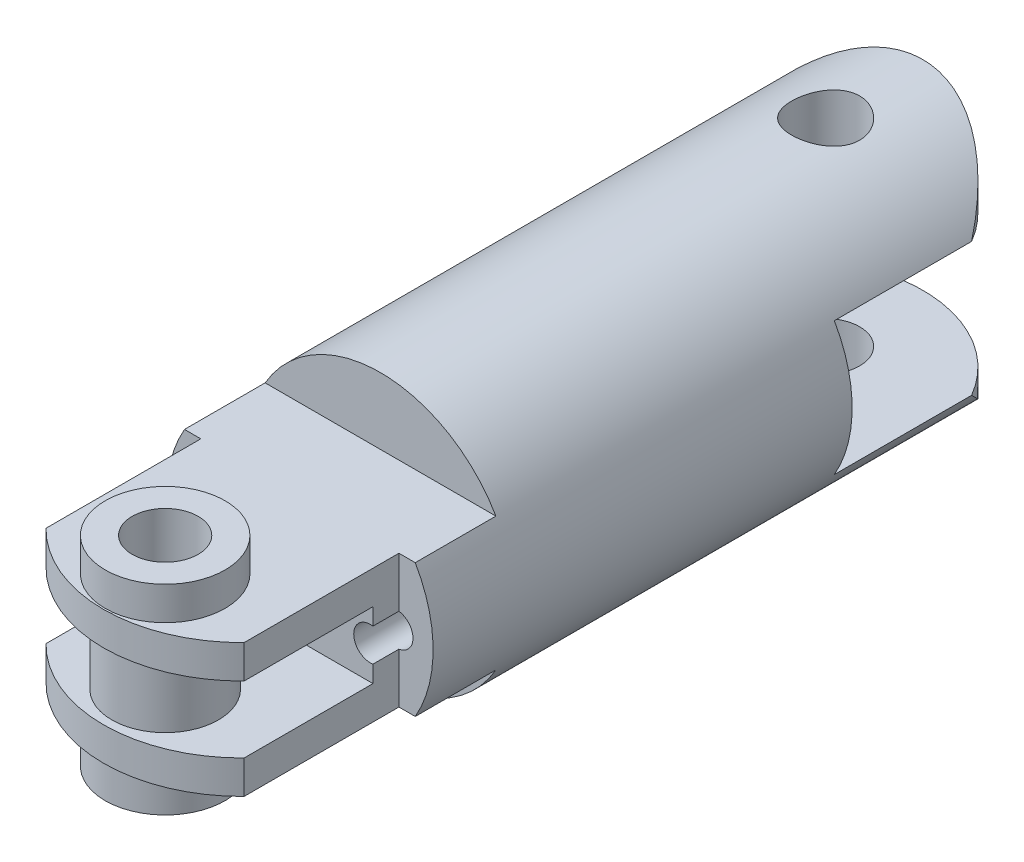
from build123d import *
from build123d.topology import SkipClean

# Parameters (mm, degrees)
SKETCH2_R                       = 10
PHALANGE_LENGTH_DEPTH           = 33.4
BOSS_EXTRUDE3_DEPTH             = 5
BOSS_EXTRUDE4_DEPTH             = 5
BOSS_EXTRUDE4_DEPTH_BACK        = 5
CUT_EXTRUDE2_START              = -15.3025
CUT_EXTRUDE2_DEPTH              = 15.3025
SKETCH7_R                       = 1.65
CUT_EXTRUDE3_DEPTH              = 10
CUT_EXTRUDE4_DEPTH              = 2.5
CUT_EXTRUDE4_DEPTH_BACK         = 2.5
CUT_EXTRUDE7_REACH              = 53.978
SKETCH4_R                       = 1.65
CUT_EXTRUDE7_DIRECTION_2_REACH  = 53.978
CUT_EXTRUDE_THIN1_START         = 33.4
CUT_EXTRUDE_THIN1_DEPTH         = 10.361670454
BOSS_EXTRUDE5_REACH             = 53.313
SKETCH9_R                       = 4
SKETCH9_R_2                     = 1.65
CUT_EXTRUDE8_REACH              = 52.714
SKETCH10_R                      = 1.25
CUT_EXTRUDE9_START              = -8
CUT_EXTRUDE9_DEPTH              = 8
CUT_EXTRUDE10_REACH             = 53.313
CUT_EXTRUDE10_DIRECTION_2_REACH = 53.313
CUT_EXTRUDE11_START             = -10
CUT_EXTRUDE11_OUTLINE_W         = 2.565773848
CUT_EXTRUDE11_OUTLINE_H         = 11.6166929
CUT_EXTRUDE11_DEPTH             = 10
BOSS_EXTRUDE6_START             = 7.5
SKETCH14_R                      = 4.5
SKETCH14_R_2                    = 1.65
BOSS_EXTRUDE6_DEPTH             = 2.5
BOSS_EXTRUDE7_START             = -7.5
SKETCH14_2_R                    = 4.5
SKETCH14_2_R_2                  = 1.65
BOSS_EXTRUDE7_DEPTH             = 2.5
SCALE1_SCALE                    = 0.666666667
CUT_EXTRUDE12_START             = -11.666667
SKETCH15_R                      = 1.65
CUT_EXTRUDE12_DEPTH             = 13.333339
CUT_EXTRUDE13_REACH             = 39.694
SKETCH16_R                      = 1.7
CUT_EXTRUDE13_DIRECTION_2_REACH = 39.694


# Read off the part's stored shape, not the designer's step: Cut-Extrude-Thin1, Cut-Extrude11
with BuildPart() as part:
    # Sketch2 → Phalange Length (new body)
    with BuildSketch(Plane.XY):
        Circle(SKETCH2_R)
    extrude(amount=PHALANGE_LENGTH_DEPTH)

    # Sketch3 → Boss-Extrude3 (add)
    with BuildSketch(Plane(origin=(0, -10, 0), x_dir=(-1, 0, 0), z_dir=(0, -1, 0))):
        with BuildLine():
            Line((-10, 5.302499701), (-10, 0))
            Line((-10, 0), (10, 0))
            Line((10, 0), (10, 5.302499701))
            ThreePointArc((10, 5.302499701), (0, 15.302499701), (-10, 5.302499701))
        make_face()
    boss_extrude3 = extrude(amount=-BOSS_EXTRUDE3_DEPTH)

    # Mirror1: Boss-Extrude3 across plane
    add(boss_extrude3.mirror(Plane.ZX))

    # Sketch5 → Boss-Extrude4 (add, two sides: drawn at the far end of the back side and taken through both)
    with BuildSketch(Plane(origin=(0, 0, 0), x_dir=(1, 0, 0), z_dir=(0, 1, 0)).offset(-BOSS_EXTRUDE4_DEPTH_BACK)):
        with BuildLine():
            Line((-10, -39.183157911), (-10, -33.4))
            Line((-10, -33.4), (10, -33.4))
            Line((10, -33.4), (10, -39.183157911))
            ThreePointArc((10, -39.183157911), (0, -48.751984156), (-10, -39.183157911))
        make_face()
    extrude(amount=BOSS_EXTRUDE4_DEPTH + BOSS_EXTRUDE4_DEPTH_BACK)

    # Sketch6 → Cut-Extrude2 (cut)
    with SkipClean():  # the faces are left unmerged after this step: merging them gives an invalid solid
        with BuildSketch(Plane.XY.offset(CUT_EXTRUDE2_START)):
            with BuildLine():
                ThreePointArc((0, 10), (5, 8.660254038), (8.660254038, 5))
                Line((8.660254038, 5), (10, 5))
                Line((10, 5), (10, 10))
                Line((10, 10), (0, 10))
            make_face()
            with BuildLine():
                Line((10, -5), (8.660254038, -5))
                ThreePointArc((8.660254038, -5), (5, -8.660254038), (0, -10))
                Line((0, -10), (10, -10))
                Line((10, -10), (10, -5))
            make_face()
            with BuildLine():
                ThreePointArc((-8.660254038, 5), (-5, 8.660254038), (0, 10))
                Line((0, 10), (-10, 10))
                Line((-10, 10), (-10, 5))
                Line((-10, 5), (-8.660254038, 5))
            make_face()
            with BuildLine():
                Line((-10, -10), (0, -10))
                ThreePointArc((0, -10), (-5, -8.660254038), (-8.660254038, -5))
                Line((-8.660254038, -5), (-10, -5))
                Line((-10, -5), (-10, -10))
            make_face()
        extrude(amount=CUT_EXTRUDE2_DEPTH, mode=Mode.SUBTRACT)

    # Sketch7 → Cut-Extrude3 (cut)
    with SkipClean():  # the faces are left unmerged after this step: merging them gives an invalid solid
        with BuildSketch(Plane(origin=(0, 5, 0), x_dir=(1, 0, 0), z_dir=(0, 1, 0))):
            with Locations(Location((0, -41.561984156, 0), (0, 0, 270))):
                Circle(SKETCH7_R)
        extrude(amount=-CUT_EXTRUDE3_DEPTH, mode=Mode.SUBTRACT)

    # Sketch5<2> → Cut-Extrude4 (cut, two sides: drawn at the far end of the back side and taken through both)
    with BuildSketch(Plane(origin=(0, 0, 0), x_dir=(1, 0, 0), z_dir=(0, 1, 0)).offset(-CUT_EXTRUDE4_DEPTH_BACK)):
        with BuildLine():
            Line((-10, -39.183157911), (-10, -33.4))
            Line((-10, -33.4), (10, -33.4))
            Line((10, -33.4), (10, -39.183157911))
            ThreePointArc((10, -39.183157911), (0, -48.751984156), (-10, -39.183157911))
        make_face()
    extrude(amount=CUT_EXTRUDE4_DEPTH + CUT_EXTRUDE4_DEPTH_BACK, mode=Mode.SUBTRACT)

    # Sketch4 → Cut-Extrude7 (cut, up to next)
    with BuildSketch(Plane(origin=(0, -5, 0), x_dir=(1, 0, 0), z_dir=(0, 1, 0)), mode=Mode.PRIVATE) as cut_extrude7_sk1:
        with Locations(Location((0, 8.010159673, 0), (0, 0, 270))):
            Circle(SKETCH4_R)
    cut_extrude7_tool1 = extrude(cut_extrude7_sk1.sketch, amount=-CUT_EXTRUDE7_REACH, mode=Mode.PRIVATE) & part.part
    add(cut_extrude7_tool1.solids().sort_by_distance((0, -5, -8.01016))[0], mode=Mode.SUBTRACT)

    # Sketch4 → Cut-Extrude7 direction 2 (cut, up to next)
    with BuildSketch(Plane(origin=(0, -5, 0), x_dir=(1, 0, 0), z_dir=(0, 1, 0)), mode=Mode.PRIVATE) as cut_extrude7_direction_2_sk1:
        with Locations(Location((0, 8.010159673, 0), (0, 0, 270))):
            Circle(SKETCH4_R)
    cut_extrude7_direction_2_tool1 = extrude(cut_extrude7_direction_2_sk1.sketch, amount=CUT_EXTRUDE7_DIRECTION_2_REACH, mode=Mode.PRIVATE) & part.part
    add(cut_extrude7_direction_2_tool1.solids().sort_by_distance((0, -5, -8.01016))[0], mode=Mode.SUBTRACT)

    # Cut-Extrude-Thin1 outline → Cut-Extrude-Thin1 (cut)
    with SkipClean():  # the faces are left unmerged after this step: merging them gives an invalid solid
        with BuildSketch(Plane.XY.offset(CUT_EXTRUDE_THIN1_START)):
            with BuildLine():
                ThreePointArc((8.660254038, 5), (9.256147934, 3.78466979), (9.682458366, 2.5))
                Line((9.682458366, 2.5), (10, 2.5))
                Line((10, 2.5), (10, 5))
                Line((10, 5), (8.660254038, 5))
            make_face()
            with BuildLine():
                Line((10, -2.5), (9.682458366, -2.5))
                ThreePointArc((9.682458366, -2.5), (9.256147934, -3.78466979), (8.660254038, -5))
                Line((8.660254038, -5), (10, -5))
                Line((10, -5), (10, -2.5))
            make_face()
            with BuildLine():
                Line((-10, 2.5), (-9.682458366, 2.5))
                ThreePointArc((-9.682458366, 2.5), (-9.256147934, 3.78466979), (-8.660254038, 5))
                Line((-8.660254038, 5), (-10, 5))
                Line((-10, 5), (-10, 2.5))
            make_face()
            with BuildLine():
                ThreePointArc((-8.660254038, -5), (-9.256147934, -3.78466979), (-9.682458366, -2.5))
                Line((-9.682458366, -2.5), (-10, -2.5))
                Line((-10, -2.5), (-10, -5))
                Line((-10, -5), (-8.660254038, -5))
            make_face()
        extrude(amount=CUT_EXTRUDE_THIN1_DEPTH, mode=Mode.SUBTRACT)

    # Sketch9 → Boss-Extrude5 (add, up to next)
    with BuildSketch(Plane.XZ.offset(-2.5), mode=Mode.PRIVATE) as boss_extrude5_sk1:
        with Locations(Location((0, 41.561984156, 0), (0, 0, 90))):
            Circle(SKETCH9_R)
        with Locations(Location((0, 41.561984156, 0), (0, 0, 90))):
            Circle(SKETCH9_R_2, mode=Mode.SUBTRACT)
    boss_extrude5_tool1 = extrude(boss_extrude5_sk1.sketch, amount=BOSS_EXTRUDE5_REACH, mode=Mode.PRIVATE) - part.part
    add(boss_extrude5_tool1.solids().sort_by_distance((0, 2.5, 37.675121))[0])

    # Sketch10 → Cut-Extrude8 (cut, up to next)
    with BuildSketch(Plane.XY.offset(33.4), mode=Mode.PRIVATE) as cut_extrude8_sk1:
        with Locations((7.239961745, 0)):
            Circle(SKETCH10_R)
    cut_extrude8_tool1 = extrude(cut_extrude8_sk1.sketch, amount=-CUT_EXTRUDE8_REACH, mode=Mode.PRIVATE) & part.part
    # Sketch10 → Cut-Extrude8 (cut, up to next)
    with BuildSketch(Plane.XY.offset(33.4), mode=Mode.PRIVATE) as cut_extrude8_sk2:
        with Locations((-7.239961745, 0)):
            Circle(SKETCH10_R)
    cut_extrude8_tool2 = extrude(cut_extrude8_sk2.sketch, amount=-CUT_EXTRUDE8_REACH, mode=Mode.PRIVATE) & part.part
    add(cut_extrude8_tool1.solids().sort_by_distance((7.239962, 0, 33.4))[0], mode=Mode.SUBTRACT)
    add(cut_extrude8_tool2.solids().sort_by_distance((-7.239962, 0, 33.4))[0], mode=Mode.SUBTRACT)

    # Sketch11 → Cut-Extrude9 (cut)
    with SkipClean():  # the faces are left unmerged after this step: merging them gives an invalid solid
        with BuildSketch(Plane.XY.offset(33.4).offset(CUT_EXTRUDE9_START)):
            with BuildLine():
                ThreePointArc((8.660254038, 5), (0, 10), (-8.660254038, 5))
                Line((-8.660254038, 5), (8.660254038, 5))
            make_face()
            with BuildLine():
                Line((8.660254038, -5), (-8.660254038, -5))
                ThreePointArc((-8.660254038, -5), (0, -10), (8.660254038, -5))
            make_face()
        extrude(amount=CUT_EXTRUDE9_DEPTH, mode=Mode.SUBTRACT)

    # Sketch12 → Cut-Extrude10 (cut, up to next)
    with BuildSketch(Plane.XZ.offset(-2.5), mode=Mode.PRIVATE) as cut_extrude10_sk1:
        with BuildLine():
            Line((-10.033719202, 48.751984156), (-10.033719202, 41.564892021))
            Line((-10.033719202, 41.564892021), (-8.660254038, 41.564892021))
            ThreePointArc((-8.660254038, 41.564892021), (0, 46.190740593), (8.660254038, 41.564892021))
            Line((8.660254038, 41.564892021), (10.033719202, 41.564892021))
            Line((10.033719202, 41.564892021), (10.033719202, 48.751984156))
            Line((10.033719202, 48.751984156), (-10.033719202, 48.751984156))
        make_face()
    cut_extrude10_tool1 = extrude(cut_extrude10_sk1.sketch, amount=CUT_EXTRUDE10_REACH, mode=Mode.PRIVATE) & part.part
    add(cut_extrude10_tool1.solids().sort_by_distance((0, 2.5, 46.250279))[0], mode=Mode.SUBTRACT)

    # Sketch12 → Cut-Extrude10 direction 2 (cut, up to next)
    with BuildSketch(Plane.XZ.offset(-2.5), mode=Mode.PRIVATE) as cut_extrude10_direction_2_sk1:
        with BuildLine():
            Line((-10.033719202, 48.751984156), (-10.033719202, 41.564892021))
            Line((-10.033719202, 41.564892021), (-8.660254038, 41.564892021))
            ThreePointArc((-8.660254038, 41.564892021), (0, 46.190740593), (8.660254038, 41.564892021))
            Line((8.660254038, 41.564892021), (10.033719202, 41.564892021))
            Line((10.033719202, 41.564892021), (10.033719202, 48.751984156))
            Line((10.033719202, 48.751984156), (-10.033719202, 48.751984156))
        make_face()
    cut_extrude10_direction_2_tool1 = extrude(cut_extrude10_direction_2_sk1.sketch, amount=-CUT_EXTRUDE10_DIRECTION_2_REACH, mode=Mode.PRIVATE) & part.part
    add(cut_extrude10_direction_2_tool1.solids().sort_by_distance((0, 2.5, 46.250279))[0], mode=Mode.SUBTRACT)

    # Cut-Extrude11 outline → Cut-Extrude11 (cut)
    with BuildSketch(Plane.XZ.offset(5).offset(CUT_EXTRUDE11_START)):
        with Locations((-8.717113076, 37.260571369)):
            Rectangle(CUT_EXTRUDE11_OUTLINE_W, CUT_EXTRUDE11_OUTLINE_H)
        with Locations((8.717113076, 37.260571369)):
            Rectangle(CUT_EXTRUDE11_OUTLINE_W, CUT_EXTRUDE11_OUTLINE_H)
    extrude(amount=CUT_EXTRUDE11_DEPTH, mode=Mode.SUBTRACT)

    # Sketch14 → Boss-Extrude6 (add)
    with SkipClean():  # the faces are left unmerged after this step: merging them gives an invalid solid
        with BuildSketch(Plane(origin=(0, 0, 0), x_dir=(1, 0, 0), z_dir=(0, 1, 0)).offset(BOSS_EXTRUDE6_START)):
            with Locations(Location((0, -41.561984156, 0), (0, 0, 270))):
                Circle(SKETCH14_R)
            with Locations(Location((0, -41.561984156, 0), (0, 0, 270))):
                Circle(SKETCH14_R_2, mode=Mode.SUBTRACT)
        extrude(amount=-BOSS_EXTRUDE6_DEPTH)

    # Sketch14<2> → Boss-Extrude7 (add)
    with SkipClean():  # the faces are left unmerged after this step: merging them gives an invalid solid
        with BuildSketch(Plane(origin=(0, 0, 0), x_dir=(1, 0, 0), z_dir=(0, 1, 0)).offset(BOSS_EXTRUDE7_START)):
            with Locations(Location((0, -41.561984156, 0), (0, 0, 270))):
                Circle(SKETCH14_2_R)
            with Locations(Location((0, -41.561984156, 0), (0, 0, 270))):
                Circle(SKETCH14_2_R_2, mode=Mode.SUBTRACT)
        extrude(amount=BOSS_EXTRUDE7_DEPTH)


with BuildPart() as part_1:
    # Scale1: scaled about (1e-09, 6.5e-08, 14.797343539)
    add(part.part.scale(SCALE1_SCALE).moved(Location((0, 2.2e-08, 4.932447846))))

    # Sketch15 → Cut-Extrude12 (cut)
    with BuildSketch(Plane(origin=(0, 4.999995016, 0), x_dir=(1, 0, 0), z_dir=(0, 1, 0)).offset(CUT_EXTRUDE12_START)):
        with Locations(Location((-8e-09, -32.640597832, 0), (0, 0, 270))):
            Circle(SKETCH15_R)
    extrude(amount=CUT_EXTRUDE12_DEPTH, mode=Mode.SUBTRACT)

    # Sketch16 → Cut-Extrude13 (cut, up to next)
    with BuildSketch(Plane.XZ.offset(-3.33332835), mode=Mode.PRIVATE) as cut_extrude13_sk1:
        with Locations(Location((-8e-09, -0.407498054, 0), (0, 0, 270))):
            Circle(SKETCH16_R)
    cut_extrude13_tool1 = extrude(cut_extrude13_sk1.sketch, amount=-CUT_EXTRUDE13_REACH, mode=Mode.PRIVATE) & part_1.part
    add(cut_extrude13_tool1.solids().sort_by_distance((0, 3.333328, -0.407498))[0], mode=Mode.SUBTRACT)

    # Sketch16 → Cut-Extrude13 direction 2 (cut, up to next)
    with BuildSketch(Plane.XZ.offset(-3.33332835), mode=Mode.PRIVATE) as cut_extrude13_direction_2_sk1:
        with Locations(Location((-8e-09, -0.407498054, 0), (0, 0, 270))):
            Circle(SKETCH16_R)
    cut_extrude13_direction_2_tool1 = extrude(cut_extrude13_direction_2_sk1.sketch, amount=CUT_EXTRUDE13_DIRECTION_2_REACH, mode=Mode.PRIVATE) & part_1.part
    add(cut_extrude13_direction_2_tool1.solids().sort_by_distance((0, 3.333328, -0.407498))[0], mode=Mode.SUBTRACT)


solid = part_1.part
